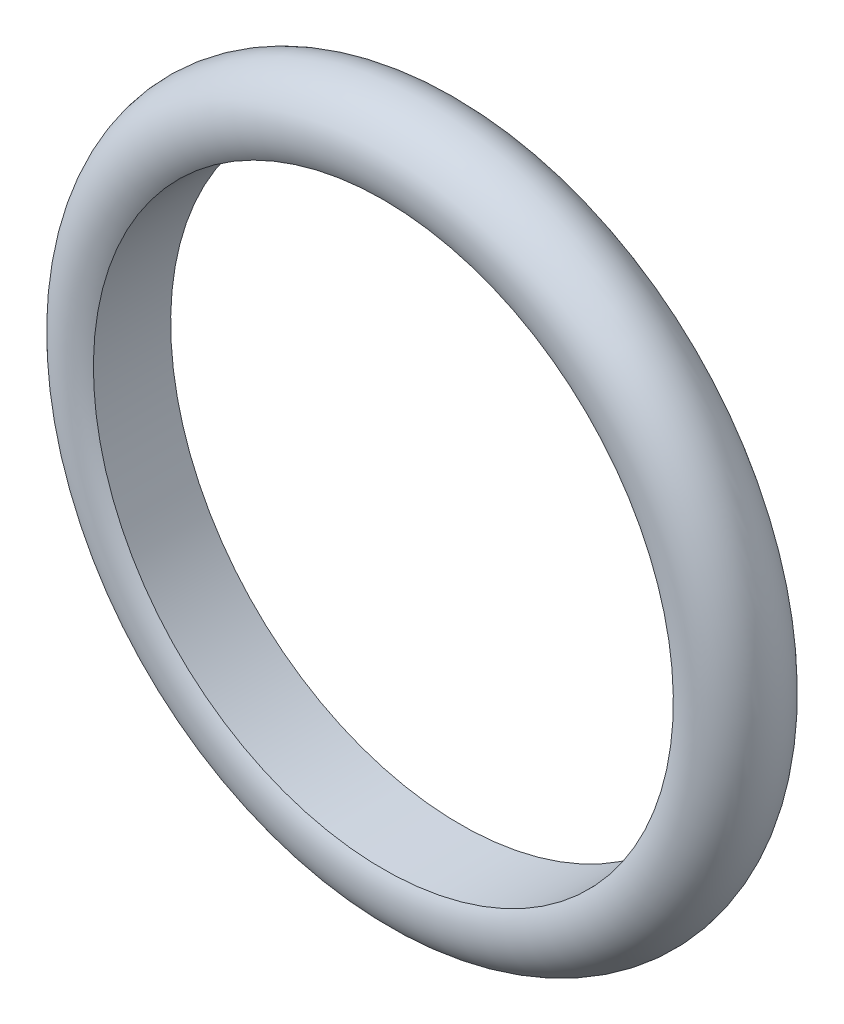
from build123d import *


with BuildPart() as part:
    # Sweep1: sweep along a path in Sketch1
    with BuildLine(Plane.XY) as sweep1_path:
        CenterArc((0, 0), 35, 0, 360)
    # Sketch2 → Sweep1 (sweep)
    with BuildSketch(Plane(origin=(0, 0, 0), x_dir=(0, 0, -1), z_dir=(1, 0, 0))):
        with BuildLine():
            Line((4.330127019, 32.5), (-4.330127019, 32.5))
            ThreePointArc((-4.330127019, 32.5), (0, 40), (4.330127019, 32.5))
        make_face()
    sweep(path=sweep1_path.line)


solid = part.part
